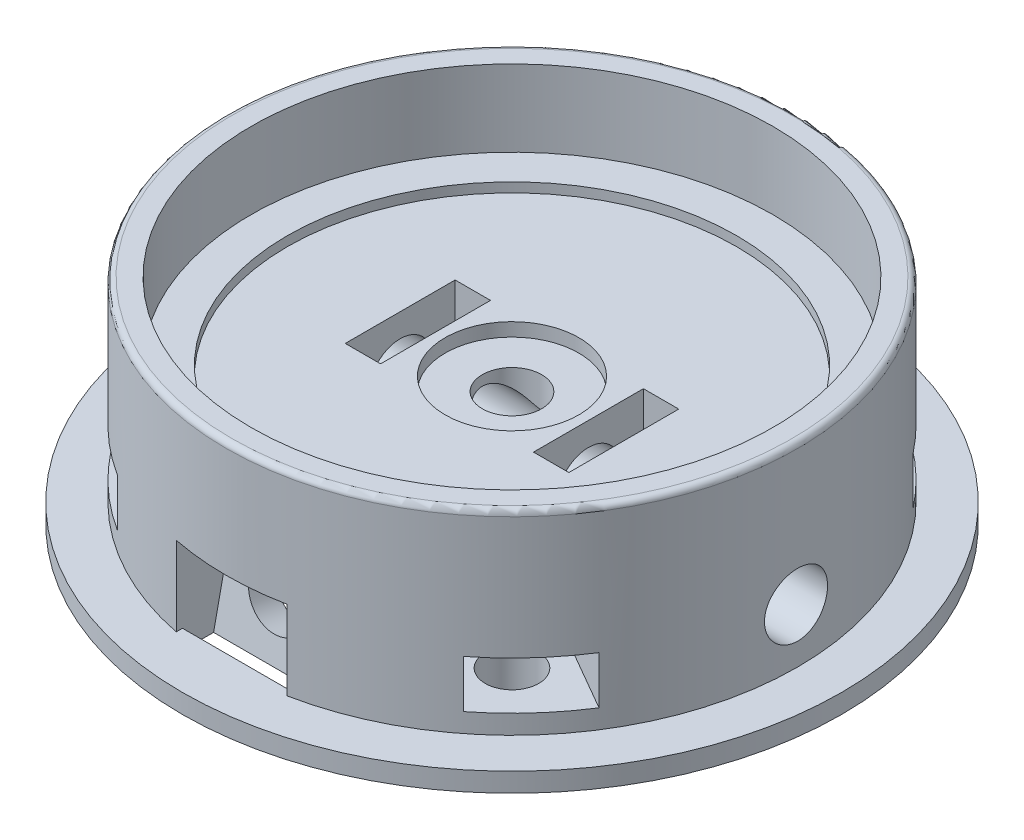
from build123d import *

# Parameters (mm, degrees)
SKETCH1_R           = 14.95
BOSS_EXTRUDE1_DEPTH = 6.2
SKETCH2_R           = 11.75
CUT_EXTRUDE1_DEPTH  = 0.5
SKETCH3_R           = 14.95
SKETCH3_R_2         = 13.65
BOSS_EXTRUDE2_DEPTH = 4
FILLET1_R           = 0.3
SKETCH4_R           = 1.55
CUT_EXTRUDE2_DEPTH  = 22.897374272
SKETCH5_R           = 1.65
CUT_EXTRUDE3_DEPTH  = 24.474347701
SKETCH6_R           = 17.25
SKETCH6_R_2         = 1.55
BOSS_EXTRUDE3_DEPTH = 1
SKETCH7_W           = 5.75
SKETCH7_H           = 5.75
CUT_EXTRUDE4_DEPTH  = 1.85
CIRPATTERN1_COUNT   = 2
CUT_EXTRUDE5_START  = -2
SKETCH9_R           = 1.65
CUT_EXTRUDE5_DEPTH  = 38.679179551
CUT_EXTRUDE6_DEPTH  = 1.8
CUT_EXTRUDE11_REACH = 39.927
SKETCH19_W          = 5.8
SKETCH19_H          = 4.150072675
CIRPATTERN2_COUNT   = 2
SKETCH16_R          = 1.4
CUT_EXTRUDE8_DEPTH  = 4.5
CUT_EXTRUDE9_DEPTH  = 2.5
CIRPATTERN3_COUNT   = 4
SKETCH18_R          = 3.5
CUT_EXTRUDE10_DEPTH = 0.7


with BuildPart() as part:
    # Sketch1 → Boss-Extrude1 (new body)
    with BuildSketch(Plane(origin=(0, 0, 0), x_dir=(1, 0, 0), z_dir=(0, 1, 0))):
        Circle(SKETCH1_R)
    extrude(amount=BOSS_EXTRUDE1_DEPTH)

    # Sketch2 → Cut-Extrude1 (cut)
    with BuildSketch(Plane(origin=(0, 6.2, 0), x_dir=(1, 0, 0), z_dir=(0, 1, 0))):
        Circle(SKETCH2_R)
    extrude(amount=-CUT_EXTRUDE1_DEPTH, mode=Mode.SUBTRACT)

    # Sketch3 → Boss-Extrude2 (add)
    with BuildSketch(Plane(origin=(0, 6.2, 0), x_dir=(1, 0, 0), z_dir=(0, 1, 0))):
        Circle(SKETCH3_R)
        Circle(SKETCH3_R_2, mode=Mode.SUBTRACT)
    extrude(amount=BOSS_EXTRUDE2_DEPTH)

    # Fillet1
    fillet1_edges = [part.edges().sort_by_distance(p)[0] for p in [
        (-14.95, 10.2, 0),
    ]]
    fillet(fillet1_edges, radius=FILLET1_R)

    # Sketch4 → Cut-Extrude2 (cut, through all)
    with BuildSketch(Plane(origin=(0, 5.7, 0), x_dir=(1, 0, 0), z_dir=(0, 1, 0))):
        Circle(SKETCH4_R)
    extrude(amount=-CUT_EXTRUDE2_DEPTH, mode=Mode.SUBTRACT)

    # Sketch5 → Cut-Extrude3 (cut, through all)
    with BuildSketch(Plane(origin=(0, 0, 0), x_dir=(0, 0, -1), z_dir=(1, 0, 0))):
        with Locations((0, 2.825)):
            Circle(SKETCH5_R)
    cut_extrude3 = extrude(amount=CUT_EXTRUDE3_DEPTH, mode=Mode.SUBTRACT)

    # Sketch6 → Boss-Extrude3 (add)
    with BuildSketch(Plane.XZ):
        Circle(SKETCH6_R)
        Circle(SKETCH6_R_2, mode=Mode.SUBTRACT)
    extrude(amount=BOSS_EXTRUDE3_DEPTH)

    # Sketch7 → Cut-Extrude4 (cut)
    with BuildSketch(Plane(origin=(4, 0, 0), x_dir=(0, 0, -1), z_dir=(1, 0, 0))):
        with Locations((0, 2.825)):
            Rectangle(SKETCH7_W, SKETCH7_H)
    cut_extrude4 = extrude(amount=CUT_EXTRUDE4_DEPTH, mode=Mode.SUBTRACT)

    # CirPattern1: Cut-Extrude3, Cut-Extrude4 ×2 about axis
    cirpattern1_axis = Axis((0, 9.9, 0), (0, -1, 0))
    add([cut_extrude3.rotate(cirpattern1_axis, i * 360 / CIRPATTERN1_COUNT) for i in range(1, CIRPATTERN1_COUNT)], mode=Mode.SUBTRACT)
    add([cut_extrude4.rotate(cirpattern1_axis, i * 360 / CIRPATTERN1_COUNT) for i in range(1, CIRPATTERN1_COUNT)], mode=Mode.SUBTRACT)

    # Sketch9 → Cut-Extrude5 (cut)
    with BuildSketch(Plane(origin=(0, 0.418934665, 12.410952688), x_dir=(0, -0.9781476007338056, 0.2079116908177598), z_dir=(0, 0.2079116908177598, 0.9781476007338056)).offset(CUT_EXTRUDE5_START)):
        with Locations((-1.471706086, 0)):
            Circle(SKETCH9_R)
    cut_extrude5 = extrude(amount=CUT_EXTRUDE5_DEPTH, mode=Mode.SUBTRACT)

    # Sketch10 → Cut-Extrude6 (cut)
    with BuildSketch(Plane(origin=(0, 0, 12.5), x_dir=(0, -0.9781476007338056, 0.2079116908177598), z_dir=(0, 0.2079116908177598, 0.9781476007338056))):
        Polygon((1, 2.9), (-4.8, 2.9), (-4.8, -2.9), (1, -2.9), (3, -2.9), (3, 2.9), align=None)
    cut_extrude6 = extrude(amount=CUT_EXTRUDE6_DEPTH, mode=Mode.SUBTRACT)

    # Cut-Sweep1: sweep along a path in Sketch14
    with BuildLine(Plane(origin=(0, 0, 0), x_dir=(0, -1, 0), z_dir=(-1, 0, 0))) as cut_sweep1_path:
        ThreePointArc((-3.160556446, 10.294692096), (-0.851753645, 4.580204634), (3.272281132, 0))
    # Sketch13 → Cut-Sweep1 (sweep, cut)
    with BuildSketch(Plane(origin=(0, 2.230236483, 10.492437709), x_dir=(-1, 0, 0), z_dir=(0, 0.2079116908177598, 0.9781476007338056))):
        with BuildLine():
            Line((-2.490185445, -0.207457245), (-3.875584776, 3.598896135))
            Line((-3.875584776, 3.598896135), (3.875584776, 3.598896135))
            Line((3.875584776, 3.598896135), (2.490185445, -0.207457245))
            ThreePointArc((2.490185445, -0.207457245), (0, -1.951103865), (-2.490185445, -0.207457245))
        make_face()
    cut_sweep1 = sweep(path=cut_sweep1_path.line, mode=Mode.SUBTRACT)

    # Cut-Extrude11: up to this plane
    cut_extrude11_end = Plane(origin=(0, 2.916345063, 13.720324792), z_dir=(0, -0.20791169081775973, -0.9781476007338056))
    # Sketch19 → Cut-Extrude11 (cut, up to the surface)
    with BuildSketch(Plane.XY.offset(14.95), mode=Mode.PRIVATE) as cut_extrude11_sk1:
        with Locations((0, 2.075036338)):
            Rectangle(SKETCH19_W, SKETCH19_H)
    cut_extrude11_tool1 = split(extrude(cut_extrude11_sk1.sketch, amount=-CUT_EXTRUDE11_REACH, mode=Mode.PRIVATE), bisect_by=cut_extrude11_end, keep=Keep.BOTH, mode=Mode.PRIVATE)
    cut_extrude11 = cut_extrude11_tool1.solids().sort_by_distance((0, 2.075036, 14.95))[0]
    add(cut_extrude11, mode=Mode.SUBTRACT)

    # CirPattern2: Cut-Extrude5, Cut-Extrude6, Cut-Sweep1, Cut-Extrude11 ×2 about axis
    cirpattern2_axis = Axis((0, 9.9, 0), (0, -1, 0))
    add([cut_extrude5.rotate(cirpattern2_axis, i * 360 / CIRPATTERN2_COUNT) for i in range(1, CIRPATTERN2_COUNT)], mode=Mode.SUBTRACT)
    add([cut_extrude6.rotate(cirpattern2_axis, i * 360 / CIRPATTERN2_COUNT) for i in range(1, CIRPATTERN2_COUNT)], mode=Mode.SUBTRACT)
    add([cut_sweep1.rotate(cirpattern2_axis, i * 360 / CIRPATTERN2_COUNT) for i in range(1, CIRPATTERN2_COUNT)], mode=Mode.SUBTRACT)
    add([cut_extrude11.rotate(cirpattern2_axis, i * 360 / CIRPATTERN2_COUNT) for i in range(1, CIRPATTERN2_COUNT)], mode=Mode.SUBTRACT)

    # Sketch16 → Cut-Extrude8 (cut)
    with BuildSketch(Plane.XZ.offset(1)):
        with Locations((-8.520636713, 8.520636713)):
            Circle(SKETCH16_R)
    cut_extrude8 = extrude(amount=-CUT_EXTRUDE8_DEPTH, mode=Mode.SUBTRACT)

    # Sketch17 → Cut-Extrude9 (cut)
    with BuildSketch(Plane.XZ.offset(-3.5)):
        Polygon((-11.349653032, 8.520636713), (-9.935144873, 6.070636713), (-7.106128554, 6.070636713), (-5.691620394, 8.520636713), (-7.106128554, 10.970636713), (-8.054171371, 12.61269504), (-12.297695849, 10.16269504), align=None)
    cut_extrude9 = extrude(amount=CUT_EXTRUDE9_DEPTH, mode=Mode.SUBTRACT)

    # CirPattern3: Cut-Extrude8, Cut-Extrude9 ×4 about axis
    cirpattern3_axis = Axis((0, 9.9, 0), (0, -1, 0))
    add([cut_extrude8.rotate(cirpattern3_axis, i * 360 / CIRPATTERN3_COUNT) for i in range(1, CIRPATTERN3_COUNT)], mode=Mode.SUBTRACT)
    add([cut_extrude9.rotate(cirpattern3_axis, i * 360 / CIRPATTERN3_COUNT) for i in range(1, CIRPATTERN3_COUNT)], mode=Mode.SUBTRACT)

    # Sketch18 → Cut-Extrude10 (cut)
    with BuildSketch(Plane(origin=(0, 5.7, 0), x_dir=(1, 0, 0), z_dir=(0, 1, 0))):
        Circle(SKETCH18_R)
    extrude(amount=-CUT_EXTRUDE10_DEPTH, mode=Mode.SUBTRACT)


solid = part.part
